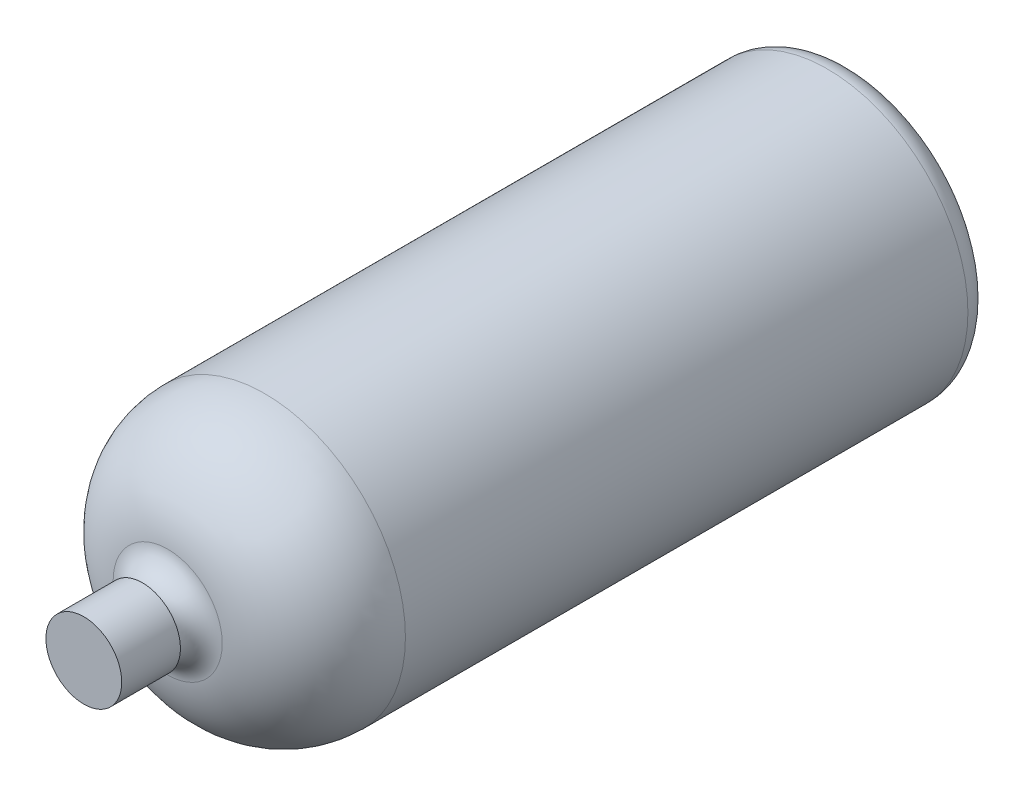
from build123d import *

# Parameters (mm, degrees)
SKETCH1_R           = 57.5
BOSS_EXTRUDE1_DEPTH = 280
FILLET1_R           = 40
SKETCH2_R           = 13.5
BOSS_EXTRUDE2_DEPTH = 10
SKETCH3_R           = 15.5
BOSS_EXTRUDE3_DEPTH = 24
FILLET2_R           = 10
FILLET3_R           = 10


with BuildPart() as part:
    # Sketch1 → Boss-Extrude1 (new body)
    with BuildSketch(Plane.XY):
        Circle(SKETCH1_R)
    extrude(amount=BOSS_EXTRUDE1_DEPTH)

    # Fillet1
    fillet1_edges = [part.edges().sort_by_distance(p)[0] for p in [
        (-57.5, 0, 280),
    ]]
    fillet(fillet1_edges, radius=FILLET1_R)

    # Sketch2 → Boss-Extrude2 (add)
    with BuildSketch(Plane.XY.offset(280)):
        Circle(SKETCH2_R)
    extrude(amount=BOSS_EXTRUDE2_DEPTH)

    # Sketch3 → Boss-Extrude3 (add)
    with BuildSketch(Plane.XY.offset(290)):
        Circle(SKETCH3_R)
    extrude(amount=BOSS_EXTRUDE3_DEPTH)

    # Fillet2
    fillet2_edges = [part.edges().sort_by_distance(p)[0] for p in [
        (-13.5, 0, 280),
    ]]
    fillet(fillet2_edges, radius=FILLET2_R - 0.0001)  # a hair under: the kernel refuses the full size

    # Fillet3
    fillet3_edges = [part.edges().sort_by_distance(p)[0] for p in [
        (-57.5, 0, 0),
    ]]
    fillet(fillet3_edges, radius=FILLET3_R)


solid = part.part
